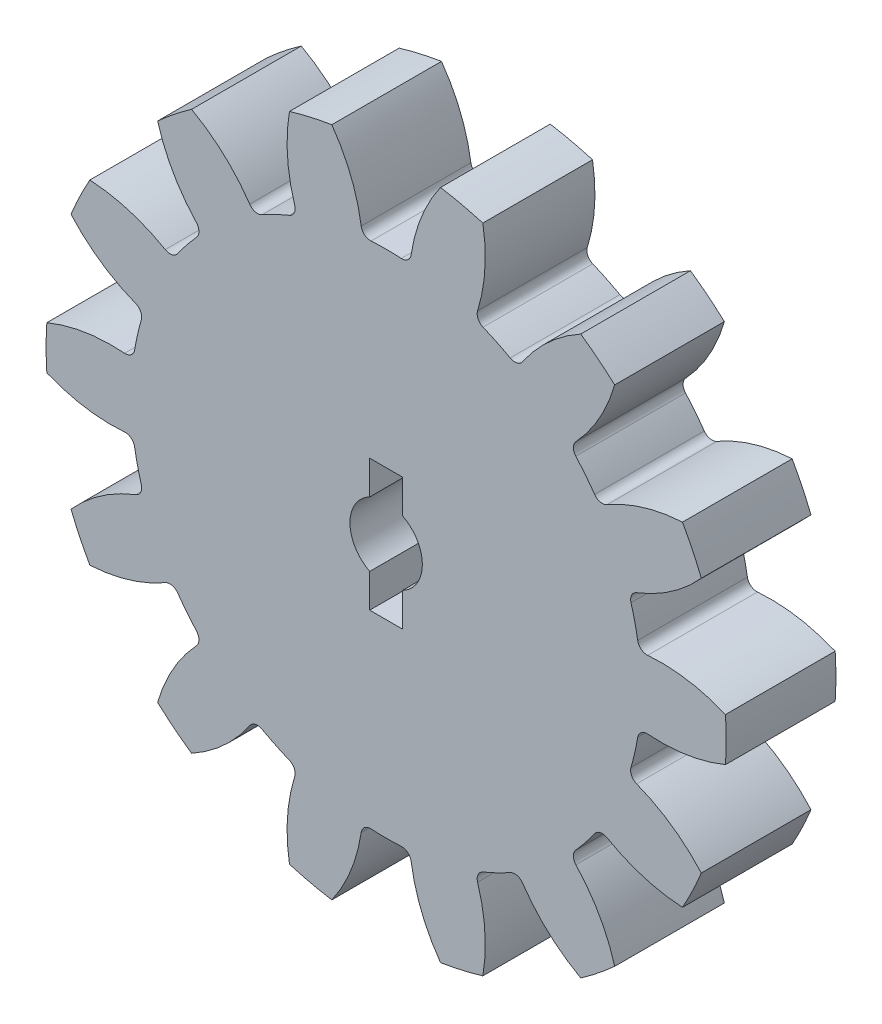
from build123d import *

# Parameters (mm, degrees)
SKETCH1_R                      = 15.5
BOSS_EXTRUDE1_DEPTH            = 2.5
CUT_EXTRUDE1_DEPTH             = 23.062411473
FILLET2_R                      = 0.43
CIRPATTERN1_COUNT              = 14
FILLET2_OF_CIRPATTERN1_R       = 0.43
THROUGH_CENTER_HOLE_DEPTH      = 22.922945853
THROUGH_CENTER_HOLE_DEPTH_BACK = 22.922945853


with BuildPart() as part:
    # Sketch1 → Boss-Extrude1 (new, symmetric)
    with BuildSketch(Plane.XY):
        Circle(SKETCH1_R)
    extrude(amount=BOSS_EXTRUDE1_DEPTH, both=True)

    # Sketch3 → Cut-Extrude1 (cut, symmetric)
    with BuildSketch(Plane.XY):
        with BuildLine():
            ThreePointArc((-2.476782545, 15.300834887), (-1.537499762, 13.528797336), (-1.089915897, 11.573794034))
            ThreePointArc((-1.089915897, 11.573794034), (0, 11.625), (1.089915897, 11.573794034))
            ThreePointArc((1.089915897, 11.573794034), (1.537499762, 13.528797336), (2.476782545, 15.300834887))
            ThreePointArc((2.476782545, 15.300834887), (0, 15.5), (-2.476782545, 15.300834887))
        make_face()
    cut_extrude1 = extrude(amount=CUT_EXTRUDE1_DEPTH, both=True, mode=Mode.SUBTRACT)

    # Fillet2
    fillet2_edges = [part.edges().sort_by_distance(p)[0] for p in [
        (-1.089915897, 11.573794034, 0),
        (1.089915897, 11.573794034, 0),
    ]]
    fillet(fillet2_edges, radius=FILLET2_R)

    # CirPattern1: Cut-Extrude1 ×14 about axis
    cirpattern1_axis = Axis((0, 0, 2.5), (0, 0, -1))
    for i in range(1, CIRPATTERN1_COUNT):
        add(cut_extrude1.rotate(cirpattern1_axis, i * 360 / CIRPATTERN1_COUNT), mode=Mode.SUBTRACT)

    # Fillet2 of CirPattern1
    fillet2_of_cirpattern1_edges = [part.edges().sort_by_distance(p)[0] for p in [
        (4.039700739, 10.900524893, 0),
        (6.003661323, 9.954731323, 0),
        (8.3692051, 8.068273111, 0),
        (9.728307994, 6.364011987, 0),
        (11.04108575, 3.638000888, 0),
        (11.526143957, 1.512822028, 0),
        (11.526143957, -1.512822028, 0),
        (11.04108575, -3.638000888, 0),
        (9.728307994, -6.364011987, 0),
        (8.3692051, -8.068273111, 0),
        (6.003661323, -9.954731323, 0),
        (4.039700739, -10.900524893, 0),
        (1.089915897, -11.573794034, 0),
        (-1.089915897, -11.573794034, 0),
        (-4.039700739, -10.900524893, 0),
        (-6.003661323, -9.954731323, 0),
        (-8.3692051, -8.068273111, 0),
        (-9.728307994, -6.364011987, 0),
        (-11.04108575, -3.638000888, 0),
        (-11.526143957, -1.512822028, 0),
        (-11.526143957, 1.512822028, 0),
        (-11.04108575, 3.638000888, 0),
        (-9.728307994, 6.364011987, 0),
        (-8.3692051, 8.068273111, 0),
        (-6.003661323, 9.954731323, 0),
        (-4.039700739, 10.900524893, 0),
    ]]
    fillet(fillet2_of_cirpattern1_edges, radius=FILLET2_OF_CIRPATTERN1_R)

    # Sketch4 → Through_Center_Hole (cut, two sides: drawn at the far end of the back side and taken through both)
    with BuildSketch(Plane.XY.offset(-THROUGH_CENTER_HOLE_DEPTH_BACK)):
        with BuildLine():
            Line((-0.75, 3), (0.75, 3))
            Line((0.75, 3), (0.75, 1.469693846))
            ThreePointArc((0.75, 1.469693846), (1.65, 0), (0.75, -1.469693846))
            Line((0.75, -1.469693846), (0.75, -3))
            Line((0.75, -3), (-0.75, -3))
            Line((-0.75, -3), (-0.75, -1.469693846))
            ThreePointArc((-0.75, -1.469693846), (-1.65, 0), (-0.75, 1.469693846))
            Line((-0.75, 1.469693846), (-0.75, 3))
        make_face()
    extrude(amount=THROUGH_CENTER_HOLE_DEPTH + THROUGH_CENTER_HOLE_DEPTH_BACK, mode=Mode.SUBTRACT)


solid = part.part
